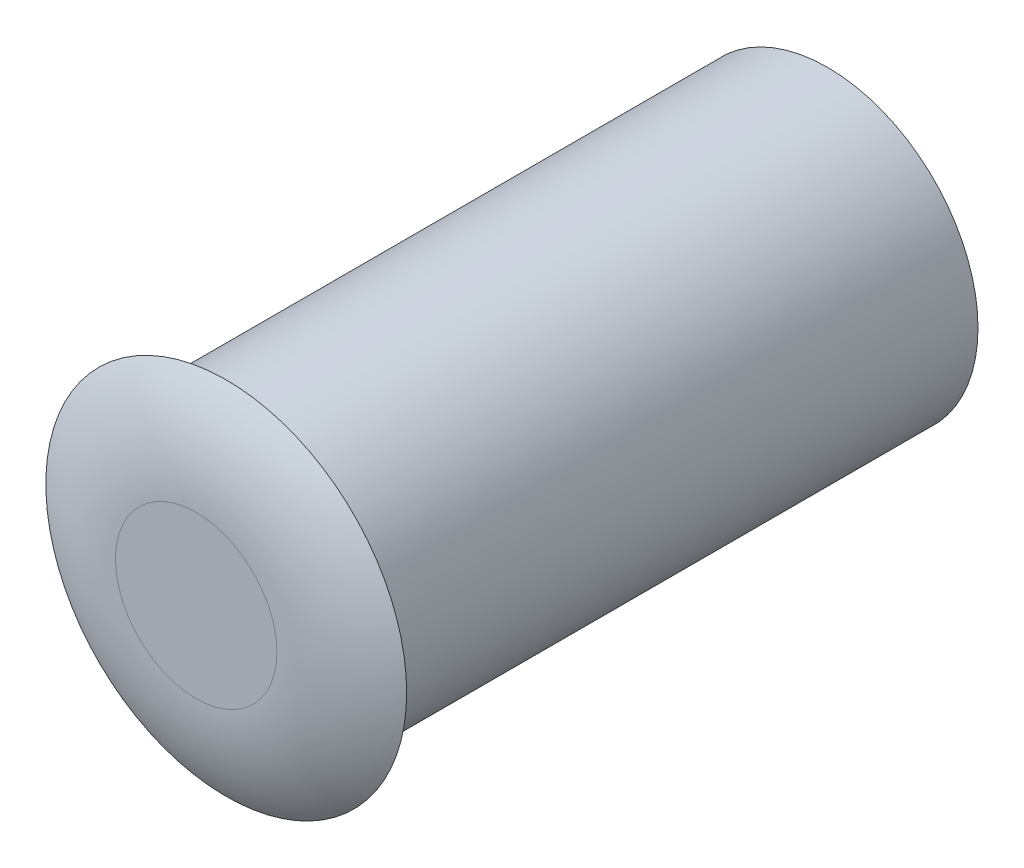
from build123d import *

# Parameters (mm, degrees)
SKETCH1_R           = 5
BOSS_EXTRUDE2_DEPTH = 20
SKETCH1_4_R         = 6
BOSS_EXTRUDE3_DEPTH = 1
FILLET1_R           = 6


with BuildPart() as part:
    # Sketch1 → Boss-Extrude2 (new body)
    with BuildSketch(Plane.XY):
        Circle(SKETCH1_R)
    extrude(amount=-BOSS_EXTRUDE2_DEPTH)


with BuildPart() as body_2:
    # Sketch1<4> → Boss-Extrude3 (new body)
    with BuildSketch(Plane.XY):
        Circle(SKETCH1_4_R)
    extrude(amount=BOSS_EXTRUDE3_DEPTH)

    # Fillet1
    # the kernel refuses this fillet: 6 mm, written as the material it takes off along each edge
    with BuildSketch(Plane(origin=(0, 0, 1), x_dir=(1, 0, 0), z_dir=(0, -1, 0))) as fillet1_piece_1:
        with BuildLine():
            CenterArc((2.68337521, -6), FILLET1_R, 56.442690238, 33.557309762)
            Line((2.68337521, 0), (2.68337521, 0.12))
            Line((2.68337521, 0.12), (6, 0.12))
            Line((6, 0.12), (6.12, 0))
            ThreePointArc((6.12, 0), (6.12, -0.5), (6.066332496, -0.9))
            Line((6.066332496, -0.9), (6, -1))
        make_face()
    revolve(axis=Axis((0, 0, 1), (0, 0, 1)), mode=Mode.SUBTRACT)


solid = Compound([part.part, body_2.part])
